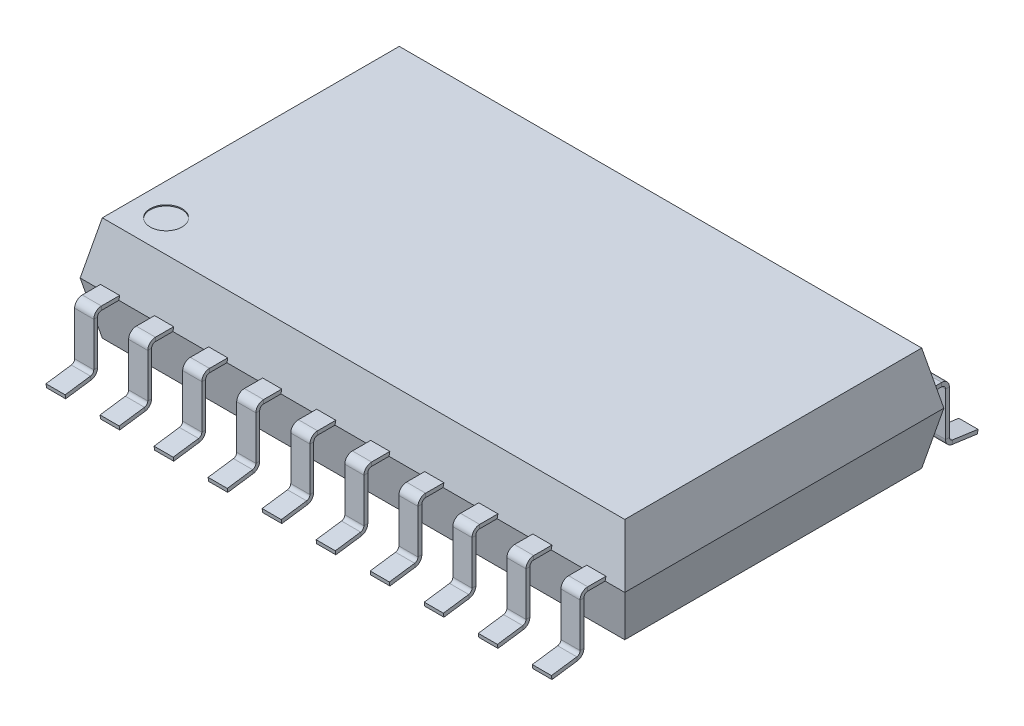
from build123d import *

# Parameters (mm, degrees)
SKETCH1_W                     = 12.8
SKETCH1_H                     = 7.5
BOSS_EXTRUDE1_DEPTH           = 1.225
BOSS_EXTRUDE1_TAPER           = 12
BOSS_EXTRUDE1_OTHER_WAY_DEPTH = 1.225
BOSS_EXTRUDE1_OTHER_WAY_TAPER = 12
BASE_FLANGE1_DEPTH            = 0.225
BASE_FLANGE1_DEPTH_BACK       = 0.225
LPATTERN1_COUNT               = 6
LPATTERN1_PITCH               = 1.27
LPATTERN1_2_COUNT             = 5
LPATTERN1_2_PITCH             = 1.27
BASE_FLANGE2_DEPTH            = 0.225
BASE_FLANGE2_DEPTH_BACK       = 0.225
LPATTERN2_COUNT               = 5
LPATTERN2_PITCH               = 1.27
LPATTERN2_2_COUNT             = 6
LPATTERN2_2_PITCH             = 1.27
SKETCH87_R                    = 0.375
CUT_EXTRUDE1_DEPTH            = 0.025


# Sheet-metal steps are written as plain solids
with BuildPart() as part:
    # Sketch1 → Boss-Extrude1 (new body)
    with BuildSketch(Plane(origin=(0, 0, 0), x_dir=(1, 0, 0), z_dir=(0, 1, 0))):
        Rectangle(SKETCH1_W, SKETCH1_H)
    extrude(amount=BOSS_EXTRUDE1_DEPTH, taper=BOSS_EXTRUDE1_TAPER)

    # Sketch1 → Boss-Extrude1 other way (add)
    with BuildSketch(Plane(origin=(0, 0, 0), x_dir=(1, 0, 0), z_dir=(0, 1, 0))):
        Rectangle(SKETCH1_W, SKETCH1_H)
    extrude(amount=-BOSS_EXTRUDE1_OTHER_WAY_DEPTH, taper=BOSS_EXTRUDE1_OTHER_WAY_TAPER)

    # Sketch87 → Cut-Extrude1 (cut)
    with BuildSketch(Plane(origin=(0, 1.225, 0), x_dir=(1, 0, 0), z_dir=(0, 1, 0))):
        with Locations(Location((-5.389618212, -2.739618212, 0), (0, 0, 270))):
            Circle(SKETCH87_R)
    extrude(amount=-CUT_EXTRUDE1_DEPTH, mode=Mode.SUBTRACT)


with BuildPart() as body_2:
    # Sketch2 → Base-Flange1 (new, two sides: drawn at the far end of the back side and taken through both)
    with BuildSketch(Plane(origin=(-0.635, 0, 0), x_dir=(0, 0, -1), z_dir=(1, 0, 0)).offset(-BASE_FLANGE1_DEPTH_BACK)):
        with BuildLine():
            Line((-3.65, 0), (-3.75, 0))
            Line((-3.75, 0), (-4.16, 0))
            ThreePointArc((-4.16, 0), (-4.22363961, -0.02636039), (-4.25, -0.09))
            Line((-4.25, -0.09), (-4.25, -1.118528387))
            ThreePointArc((-4.25, -1.118528387), (-4.294152276, -1.236619012), (-4.404948842, -1.29677664))
            Line((-4.404948842, -1.29677664), (-5, -1.380405626))
            Line((-5, -1.380405626), (-5.012525579, -1.2912815))
            Line((-5.012525579, -1.2912815), (-4.417474421, -1.207652513))
            ThreePointArc((-4.417474421, -1.207652513), (-4.362076138, -1.1775737), (-4.34, -1.118528387))
            Line((-4.34, -1.118528387), (-4.34, -0.09))
            ThreePointArc((-4.34, -0.09), (-4.287279221, 0.037279221), (-4.16, 0.09))
            Line((-4.16, 0.09), (-3.75, 0.09))
            Line((-3.75, 0.09), (-3.65, 0.09))
            Line((-3.65, 0.09), (-3.65, 0))
        make_face()
    extrude(amount=BASE_FLANGE1_DEPTH + BASE_FLANGE1_DEPTH_BACK)


with BuildPart() as lpattern1_1:
    # LPattern1: pattern copy
    add(body_2.part.moved(Location(Vector(1, 0, 0) * (1 * LPATTERN1_PITCH))))


with BuildPart() as lpattern1_2:
    # LPattern1: pattern copy
    add(body_2.part.moved(Location(Vector(1, 0, 0) * (2 * LPATTERN1_PITCH))))


with BuildPart() as lpattern1_3:
    # LPattern1: pattern copy
    add(body_2.part.moved(Location(Vector(1, 0, 0) * (3 * LPATTERN1_PITCH))))


with BuildPart() as lpattern1_4:
    # LPattern1: pattern copy
    add(body_2.part.moved(Location(Vector(1, 0, 0) * (4 * LPATTERN1_PITCH))))


with BuildPart() as lpattern1_5:
    # LPattern1: pattern copy
    add(body_2.part.moved(Location(Vector(1, 0, 0) * (5 * LPATTERN1_PITCH))))


with BuildPart() as lpattern1_2_1:
    # LPattern1 2: pattern copy
    add(body_2.part.moved(Location(Vector(-1, 0, 0) * (1 * LPATTERN1_2_PITCH))))


with BuildPart() as lpattern1_2_2:
    # LPattern1 2: pattern copy
    add(body_2.part.moved(Location(Vector(-1, 0, 0) * (2 * LPATTERN1_2_PITCH))))


with BuildPart() as lpattern1_2_3:
    # LPattern1 2: pattern copy
    add(body_2.part.moved(Location(Vector(-1, 0, 0) * (3 * LPATTERN1_2_PITCH))))


with BuildPart() as lpattern1_2_4:
    # LPattern1 2: pattern copy
    add(body_2.part.moved(Location(Vector(-1, 0, 0) * (4 * LPATTERN1_2_PITCH))))


with BuildPart() as body_12:
    # Sketch58 → Base-Flange2 (new, two sides: drawn at the far end of the back side and taken through both)
    with BuildSketch(Plane(origin=(-0.635, 0, 0), x_dir=(0, 0, -1), z_dir=(1, 0, 0)).offset(-BASE_FLANGE2_DEPTH_BACK)):
        with BuildLine():
            Line((3.65, 0), (3.75, 0))
            Line((3.75, 0), (4.16, 0))
            ThreePointArc((4.16, 0), (4.22363961, -0.02636039), (4.25, -0.09))
            Line((4.25, -0.09), (4.25, -1.118528387))
            ThreePointArc((4.25, -1.118528387), (4.294152276, -1.236619012), (4.404948842, -1.29677664))
            Line((4.404948842, -1.29677664), (5, -1.380405626))
            Line((5, -1.380405626), (5.012525579, -1.2912815))
            Line((5.012525579, -1.2912815), (4.417474421, -1.207652513))
            ThreePointArc((4.417474421, -1.207652513), (4.362076138, -1.1775737), (4.34, -1.118528387))
            Line((4.34, -1.118528387), (4.34, -0.09))
            ThreePointArc((4.34, -0.09), (4.287279221, 0.037279221), (4.16, 0.09))
            Line((4.16, 0.09), (3.75, 0.09))
            Line((3.75, 0.09), (3.65, 0.09))
            Line((3.65, 0.09), (3.65, 0))
        make_face()
    extrude(amount=BASE_FLANGE2_DEPTH + BASE_FLANGE2_DEPTH_BACK)


with BuildPart() as lpattern2_1:
    # LPattern2: pattern copy
    add(body_12.part.moved(Location(Vector(-1, 0, 0) * (1 * LPATTERN2_PITCH))))


with BuildPart() as lpattern2_2:
    # LPattern2: pattern copy
    add(body_12.part.moved(Location(Vector(-1, 0, 0) * (2 * LPATTERN2_PITCH))))


with BuildPart() as lpattern2_3:
    # LPattern2: pattern copy
    add(body_12.part.moved(Location(Vector(-1, 0, 0) * (3 * LPATTERN2_PITCH))))


with BuildPart() as lpattern2_4:
    # LPattern2: pattern copy
    add(body_12.part.moved(Location(Vector(-1, 0, 0) * (4 * LPATTERN2_PITCH))))


with BuildPart() as lpattern2_2_1:
    # LPattern2 2: pattern copy
    add(body_12.part.moved(Location(Vector(1, 0, 0) * (1 * LPATTERN2_2_PITCH))))


with BuildPart() as lpattern2_2_2:
    # LPattern2 2: pattern copy
    add(body_12.part.moved(Location(Vector(1, 0, 0) * (2 * LPATTERN2_2_PITCH))))


with BuildPart() as lpattern2_2_3:
    # LPattern2 2: pattern copy
    add(body_12.part.moved(Location(Vector(1, 0, 0) * (3 * LPATTERN2_2_PITCH))))


with BuildPart() as lpattern2_2_4:
    # LPattern2 2: pattern copy
    add(body_12.part.moved(Location(Vector(1, 0, 0) * (4 * LPATTERN2_2_PITCH))))


with BuildPart() as lpattern2_2_5:
    # LPattern2 2: pattern copy
    add(body_12.part.moved(Location(Vector(1, 0, 0) * (5 * LPATTERN2_2_PITCH))))


solid = Compound([part.part, body_2.part, lpattern1_1.part, lpattern1_2.part, lpattern1_3.part, lpattern1_4.part, lpattern1_5.part, lpattern1_2_1.part, lpattern1_2_2.part, lpattern1_2_3.part, lpattern1_2_4.part, body_12.part, lpattern2_1.part, lpattern2_2.part, lpattern2_3.part, lpattern2_4.part, lpattern2_2_1.part, lpattern2_2_2.part, lpattern2_2_3.part, lpattern2_2_4.part, lpattern2_2_5.part])
